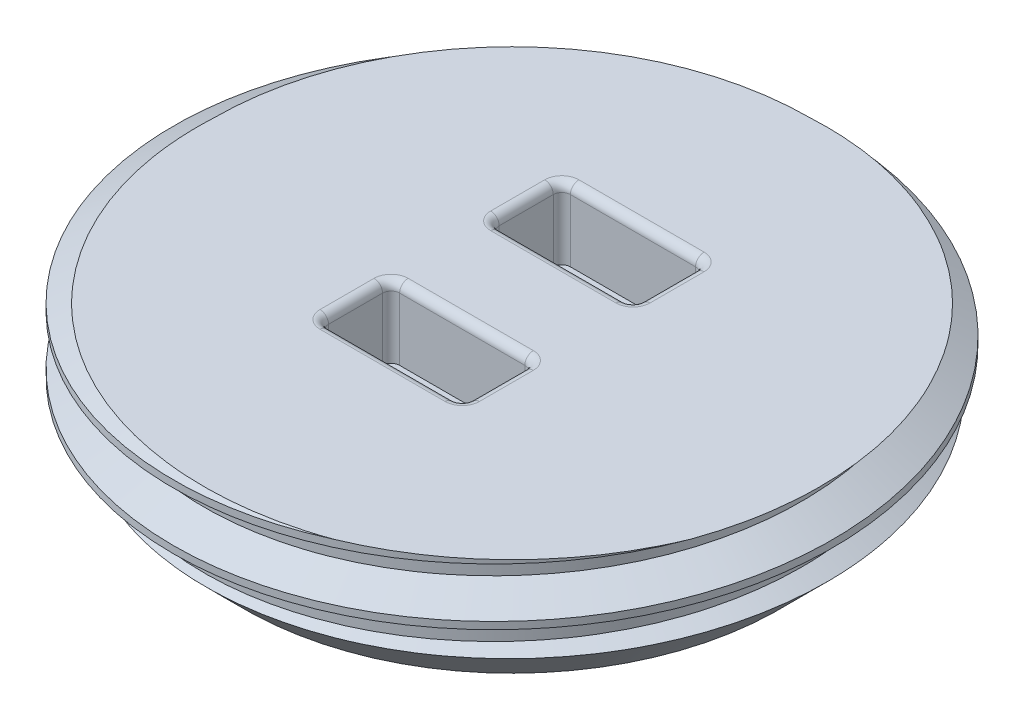
from build123d import *

# Parameters (mm, degrees)
SKETCH1_R           = 13.335
BOSS_EXTRUDE1_DEPTH = 6.35
THREAD1_PITCH       = 2.54
SKETCH4_W           = 6.35
SKETCH4_H           = 3.175
CUT_EXTRUDE1_DEPTH  = 3.175
FILLET1_R           = 0.381
SKETCH9_R           = 24.668695646
CUT_EXTRUDE3_DEPTH  = 23.380912083
CUT_EXTRUDE4_START  = -6.35
SKETCH9_2_R         = 24.668695646
CUT_EXTRUDE4_DEPTH  = 17.030912083


with BuildPart() as part:
    # Sketch1 → Boss-Extrude1 (new body)
    with BuildSketch(Plane(origin=(0, 0, 0), x_dir=(1, 0, 0), z_dir=(0, 1, 0))):
        with Locations(Location((0, 0, 0), (0, 0, 270))):
            Circle(SKETCH1_R)
    extrude(amount=BOSS_EXTRUDE1_DEPTH)

    # Thread1: the profile of Thread Profile1 profile screwed along a right-hand helix of 3.5 turns, 10 arcs to a turn; built about Z, then put on its axis
    thread1_z = Axis((0, 0, 0), (0, 0, 1))
    thread1_corners = [(13.3347, 0, -0.000173205), (14.709815322, 0, 0.793749997), (14.709815322, 0, 1.111249997), (13.3347, 0, 1.905173198)]
    with BuildLine(mode=Mode.PRIVATE) as thread1_profile:
        Line(thread1_corners[0], thread1_corners[1])
        Line(thread1_corners[1], thread1_corners[2])
        Line(thread1_corners[2], thread1_corners[3])
        Line(thread1_corners[3], thread1_corners[0])
    thread1_cap = Face(thread1_profile.wire())
    thread1_turn_angles = [0, 18, 36, 54, 72, 90, 108, 126, 144, 162, 180, 198, 216, 234, 252, 270, 288, 306, 324, 342, 360]
    thread1_turn_weights = [1, 0.9510565162951535, 1, 0.9510565162951535, 1, 0.9510565162951535, 1, 0.9510565162951535, 1, 0.9510565162951535, 1, 0.9510565162951535, 1, 0.9510565162951535, 1, 0.9510565162951535, 1, 0.9510565162951535, 1, 0.9510565162951535, 1]
    thread1_turn_rails = [Edge.make_bspline([Vector(p[0], p[1], 0).rotate(thread1_z, thread1_turn_angles[k]) / thread1_turn_weights[k] + Vector(0, 0, p[2] + THREAD1_PITCH * thread1_turn_angles[k] / 360) for k in range(21)], [0, 0, 0, 1, 1, 2, 2, 3, 3, 4, 4, 5, 5, 6, 6, 7, 7, 8, 8, 9, 9, 10, 10, 10], 2, thread1_turn_weights) for p in thread1_corners]
    thread1_turn_sides = [Face.make_surface_from_curves(thread1_turn_rails[p[0]], thread1_turn_rails[p[1]]) for p in [(0, 1), (1, 2), (2, 3), (3, 0)]]
    thread1_last_angles = [1080, 1098, 1116, 1134, 1152, 1170, 1188, 1206, 1224, 1242, 1260]
    thread1_last_weights = [1, 0.9510565162951535, 1, 0.9510565162951535, 1, 0.9510565162951535, 1, 0.9510565162951535, 1, 0.9510565162951535, 1]
    thread1_last_rails = [Edge.make_bspline([Vector(p[0], p[1], 0).rotate(thread1_z, thread1_last_angles[k]) / thread1_last_weights[k] + Vector(0, 0, p[2] + THREAD1_PITCH * thread1_last_angles[k] / 360) for k in range(11)], [0, 0, 0, 1, 1, 2, 2, 3, 3, 4, 4, 5, 5, 5], 2, thread1_last_weights) for p in thread1_corners]
    thread1_last_sides = [Face.make_surface_from_curves(thread1_last_rails[p[0]], thread1_last_rails[p[1]]) for p in [(0, 1), (1, 2), (2, 3), (3, 0)]]
    thread1 = Plane(origin=(0, 8.89, 0), x_dir=(-1, 0, 0), z_dir=(0, -1, 0)) * Solid(Shell([*[p.moved(Location((0, 0, THREAD1_PITCH * i))) for i in range(3) for p in thread1_turn_sides], *thread1_last_sides, thread1_cap, thread1_cap.rotate(thread1_z, 1260).moved(Location((0, 0, THREAD1_PITCH * 1260 / 360)))]))
    add(thread1)

    # Sketch4 → Cut-Extrude1 (cut)
    with BuildSketch(Plane(origin=(0, 6.35, 0), x_dir=(1, 0, 0), z_dir=(0, 1, 0))):
        with Locations((0, 3.81)):
            Rectangle(SKETCH4_W, SKETCH4_H)
        with Locations((0, -3.81)):
            Rectangle(SKETCH4_W, SKETCH4_H)
    extrude(amount=-CUT_EXTRUDE1_DEPTH, mode=Mode.SUBTRACT)

    # Fillet1
    fillet1_edges = [part.edges().sort_by_distance(p)[0] for p in [
        (-3.175, 4.7625, -2.2225),
        (-3.175, 4.7625, -5.3975),
        (3.175, 4.7625, -5.3975),
        (3.175, 4.7625, -2.2225),
        (-3.175, 6.35, -3.81),
        (0, 6.35, -2.2225),
        (3.175, 6.35, -3.81),
        (0, 6.35, -5.3975),
        (3.175, 4.7625, 2.2225),
        (3.175, 4.7625, 5.3975),
        (-3.175, 4.7625, 5.3975),
        (-3.175, 4.7625, 2.2225),
        (3.175, 6.35, 3.81),
        (0, 6.35, 2.2225),
        (-3.175, 6.35, 3.81),
        (0, 6.35, 5.3975),
    ]]
    fillet(fillet1_edges, radius=FILLET1_R)

    # Sketch9 → Cut-Extrude3 (cut, through all)
    with BuildSketch(Plane(origin=(0, 6.35, 0), x_dir=(1, 0, 0), z_dir=(0, 1, 0))):
        Circle(SKETCH9_R)
    extrude(amount=CUT_EXTRUDE3_DEPTH, mode=Mode.SUBTRACT)

    # Sketch9<2> → Cut-Extrude4 (cut, through all)
    with BuildSketch(Plane(origin=(0, 6.35, 0), x_dir=(1, 0, 0), z_dir=(0, 1, 0)).offset(CUT_EXTRUDE4_START)):
        Circle(SKETCH9_2_R)
    extrude(amount=-CUT_EXTRUDE4_DEPTH, mode=Mode.SUBTRACT)

    # Sketch10 → Cut-Revolve1 (revolve, cut)
    with BuildSketch(Plane(origin=(0, 0, 0), x_dir=(0, 0, -1), z_dir=(1, 0, 0)), mode=Mode.PRIVATE) as cut_revolve1_sk:
        Polygon((-16.256, 2.652479648), (-14.590479648, 2.652479648), (-11.938, 0), (-16.256, 0), align=None)
    revolve(cut_revolve1_sk.sketch.rotate(Axis((0, -1.238327687, 0), (0, 1, 0)), 288), axis=Axis((0, -1.238327687, 0), (0, 1, 0)), mode=Mode.SUBTRACT)


solid = part.part
